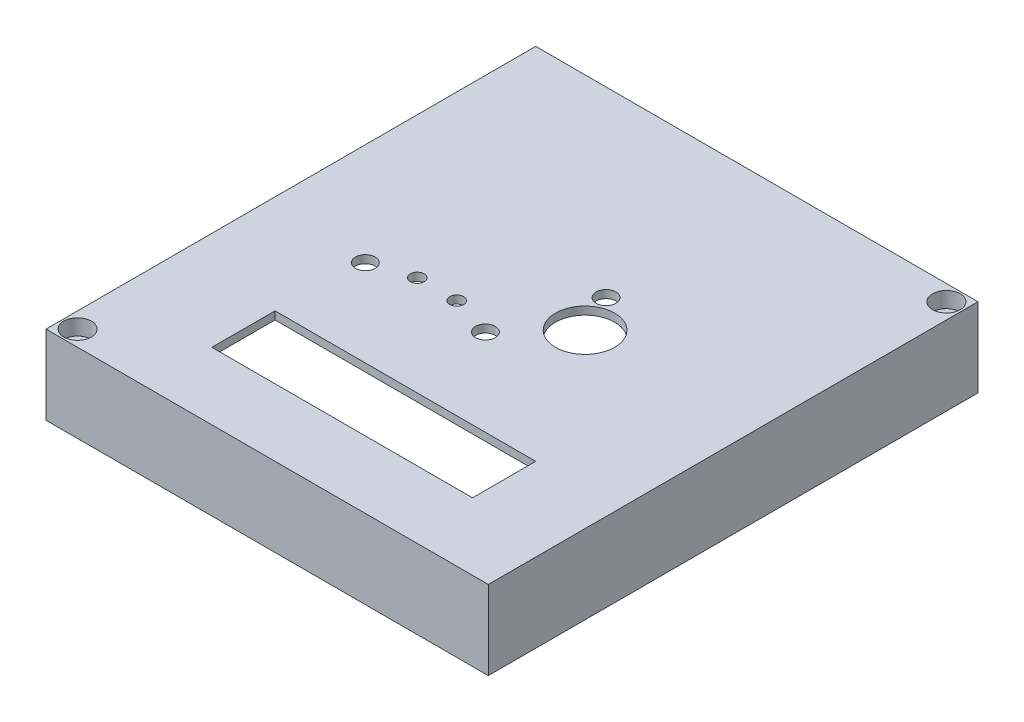
from build123d import *

# Parameters (mm, degrees)
SKETCH1_W           = 112
SKETCH1_H           = 124
BOSS_EXTRUDE1_DEPTH = 2
SKETCH4_W           = 112
SKETCH4_H           = 124
BOSS_EXTRUDE2_DEPTH = 18
CUT_EXTRUDE1_REACH  = 87.907
SKETCH5_W           = 66
SKETCH5_H           = 16
SKETCH5_R           = 7.5
SKETCH5_R_2         = 2.5
SKETCH5_R_3         = 1.75
SKETCH6_R           = 2
CUT_EXTRUDE2_DEPTH  = 86.90692638
SKETCH7_R           = 3.5
CUT_EXTRUDE3_DEPTH  = 4
CUT_EXTRUDE4_DEPTH  = 20


with BuildPart() as part:
    # Sketch1 → Boss-Extrude1 (new body)
    with BuildSketch(Plane(origin=(0, 0, 0), x_dir=(1, 0, 0), z_dir=(0, 1, 0))):
        Rectangle(SKETCH1_W, SKETCH1_H)
    extrude(amount=BOSS_EXTRUDE1_DEPTH)

    # Sketch4 → Boss-Extrude2 (add)
    with BuildSketch(Plane.XZ):
        Rectangle(SKETCH4_W, SKETCH4_H)
        Polygon((-48, 58), (-48, 54), (-52, 54), (-52, -58), (48, -58), (48, -54), (52, -54), (52, 58), align=None, mode=Mode.SUBTRACT)
    extrude(amount=BOSS_EXTRUDE2_DEPTH)

    # Sketch5 → Cut-Extrude1 (cut, up to next)
    with BuildSketch(Plane(origin=(0, 2, 0), x_dir=(1, 0, 0), z_dir=(0, 1, 0)), mode=Mode.PRIVATE) as cut_extrude1_sk1:
        with Locations((2, -37)):
            Rectangle(SKETCH5_W, SKETCH5_H)
    cut_extrude1_tool1 = extrude(cut_extrude1_sk1.sketch, amount=-CUT_EXTRUDE1_REACH, mode=Mode.PRIVATE) & part.part
    # Sketch5 → Cut-Extrude1 (cut, up to next)
    with BuildSketch(Plane(origin=(0, 2, 0), x_dir=(1, 0, 0), z_dir=(0, 1, 0)), mode=Mode.PRIVATE) as cut_extrude1_sk2:
        with Locations((12.5, 6)):
            Circle(SKETCH5_R)
    cut_extrude1_tool2 = extrude(cut_extrude1_sk2.sketch, amount=-CUT_EXTRUDE1_REACH, mode=Mode.PRIVATE) & part.part
    # Sketch5 → Cut-Extrude1 (cut, up to next)
    with BuildSketch(Plane(origin=(0, 2, 0), x_dir=(1, 0, 0), z_dir=(0, 1, 0)), mode=Mode.PRIVATE) as cut_extrude1_sk3:
        with Locations((-30.13, -7.01)):
            Circle(SKETCH5_R_2)
    cut_extrude1_tool3 = extrude(cut_extrude1_sk3.sketch, amount=-CUT_EXTRUDE1_REACH, mode=Mode.PRIVATE) & part.part
    # Sketch5 → Cut-Extrude1 (cut, up to next)
    with BuildSketch(Plane(origin=(0, 2, 0), x_dir=(1, 0, 0), z_dir=(0, 1, 0)), mode=Mode.PRIVATE) as cut_extrude1_sk4:
        with Locations((-20.25, -3.7495)):
            Circle(SKETCH5_R_3)
    cut_extrude1_tool4 = extrude(cut_extrude1_sk4.sketch, amount=-CUT_EXTRUDE1_REACH, mode=Mode.PRIVATE) & part.part
    # Sketch5 → Cut-Extrude1 (cut, up to next)
    with BuildSketch(Plane(origin=(0, 2, 0), x_dir=(1, 0, 0), z_dir=(0, 1, 0)), mode=Mode.PRIVATE) as cut_extrude1_sk5:
        with Locations((-10.25, -3.7495)):
            Circle(SKETCH5_R_3)
    cut_extrude1_tool5 = extrude(cut_extrude1_sk5.sketch, amount=-CUT_EXTRUDE1_REACH, mode=Mode.PRIVATE) & part.part
    # Sketch5 → Cut-Extrude1 (cut, up to next)
    with BuildSketch(Plane(origin=(0, 2, 0), x_dir=(1, 0, 0), z_dir=(0, 1, 0)), mode=Mode.PRIVATE) as cut_extrude1_sk6:
        with Locations((0.2695, -7.01)):
            Circle(SKETCH5_R_2)
    cut_extrude1_tool6 = extrude(cut_extrude1_sk6.sketch, amount=-CUT_EXTRUDE1_REACH, mode=Mode.PRIVATE) & part.part
    # Sketch5 → Cut-Extrude1 (cut, up to next)
    with BuildSketch(Plane(origin=(0, 2, 0), x_dir=(1, 0, 0), z_dir=(0, 1, 0)), mode=Mode.PRIVATE) as cut_extrude1_sk7:
        with Locations((8.001, 15.811)):
            Circle(SKETCH5_R_2)
    cut_extrude1_tool7 = extrude(cut_extrude1_sk7.sketch, amount=-CUT_EXTRUDE1_REACH, mode=Mode.PRIVATE) & part.part
    add(cut_extrude1_tool1.solids().sort_by_distance((2, 2, 37))[0], mode=Mode.SUBTRACT)
    add(cut_extrude1_tool2.solids().sort_by_distance((12.5, 2, -6))[0], mode=Mode.SUBTRACT)
    add(cut_extrude1_tool3.solids().sort_by_distance((-30.13, 2, 7.01))[0], mode=Mode.SUBTRACT)
    add(cut_extrude1_tool4.solids().sort_by_distance((-20.25, 2, 3.7495))[0], mode=Mode.SUBTRACT)
    add(cut_extrude1_tool5.solids().sort_by_distance((-10.25, 2, 3.7495))[0], mode=Mode.SUBTRACT)
    add(cut_extrude1_tool6.solids().sort_by_distance((0.2695, 2, 7.01))[0], mode=Mode.SUBTRACT)
    add(cut_extrude1_tool7.solids().sort_by_distance((8.001, 2, -15.811))[0], mode=Mode.SUBTRACT)

    # Sketch6 → Cut-Extrude2 (cut, through all)
    with BuildSketch(Plane(origin=(0, 2, 0), x_dir=(1, 0, 0), z_dir=(0, 1, 0))):
        with Locations((52, 58)):
            Circle(SKETCH6_R)
        with Locations((-52, -58)):
            Circle(SKETCH6_R)
    extrude(amount=-CUT_EXTRUDE2_DEPTH, mode=Mode.SUBTRACT)

    # Sketch7 → Cut-Extrude3 (cut)
    with BuildSketch(Plane(origin=(0, 2, 0), x_dir=(1, 0, 0), z_dir=(0, 1, 0))):
        with Locations((-52, -58)):
            Circle(SKETCH7_R)
        with Locations((52, 58)):
            Circle(SKETCH7_R)
    extrude(amount=-CUT_EXTRUDE3_DEPTH, mode=Mode.SUBTRACT)

    # Sketch8 → Cut-Extrude4 (cut)
    with BuildSketch(Plane.ZY.offset(56)):
        with BuildLine():
            Line((-48.75, -2.687151264), (-40.75, -2.687151264))
            ThreePointArc((-40.75, -2.687151264), (-35.75, -7.687151264), (-40.75, -12.687151264))
            Line((-40.75, -12.687151264), (-48.75, -12.687151264))
            ThreePointArc((-48.75, -12.687151264), (-53.75, -7.687151264), (-48.75, -2.687151264))
        make_face()
        with BuildLine():
            Line((-27.75, -2.687151264), (-19.75, -2.687151264))
            ThreePointArc((-19.75, -2.687151264), (-14.75, -7.687151264), (-19.75, -12.687151264))
            Line((-19.75, -12.687151264), (-27.75, -12.687151264))
            ThreePointArc((-27.75, -12.687151264), (-32.75, -7.687151264), (-27.75, -2.687151264))
        make_face()
        with BuildLine():
            Line((-4.5, -4.687151264), (0.5, -4.687151264))
            ThreePointArc((0.5, -4.687151264), (3.5, -7.687151264), (0.5, -10.687151264))
            Line((0.5, -10.687151264), (-4.5, -10.687151264))
            ThreePointArc((-4.5, -10.687151264), (-7.5, -7.687151264), (-4.5, -4.687151264))
        make_face()
    extrude(amount=-CUT_EXTRUDE4_DEPTH, mode=Mode.SUBTRACT)


solid = part.part
